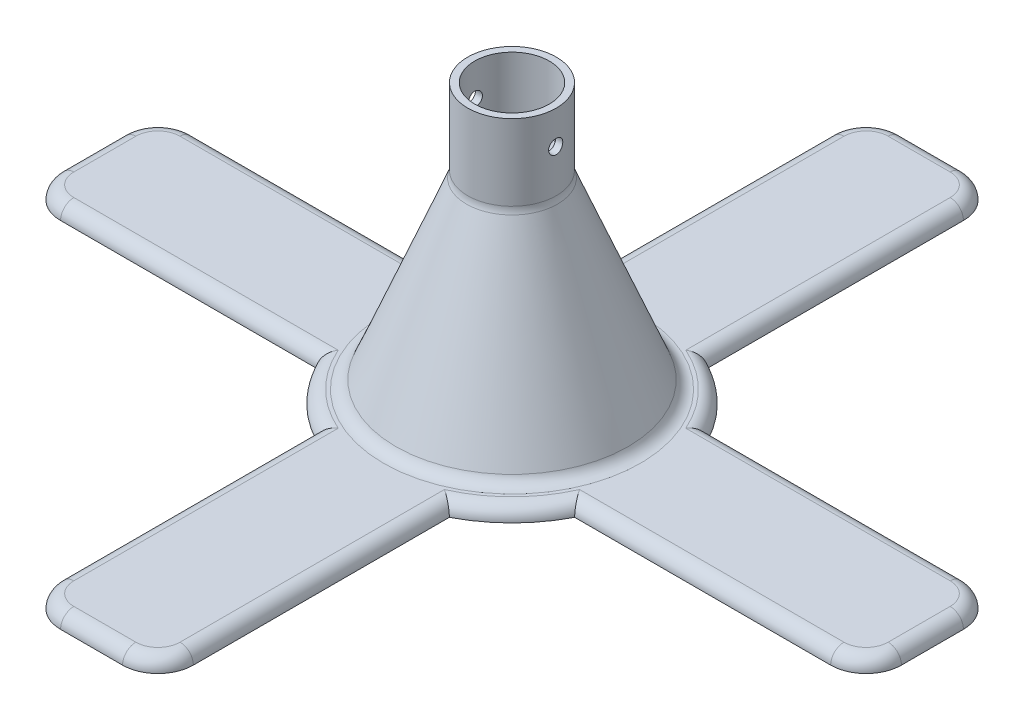
from build123d import *

# Parameters (mm, degrees)
BOSS_EXTRUDE1_DEPTH     = 3
FILLET4_R               = 8
FILLET5_R               = 3
SKETCH4_R               = 10
BOSS_EXTRUDE4_DEPTH     = 60
CHAMFER2_SIZE           = 17
CHAMFER2_SIZE2          = 42.076476508
FILLET7_R               = 4
SKETCH5_R               = 15
CUT_EXTRUDE1_DEPTH      = 32
FILLET8_R               = 3
SKETCH6_R               = 8.43
CUT_EXTRUDE2_DEPTH      = 15
FILLET9_R               = 4
CUT_EXTRUDE3_DEPTH      = 15
CUT_EXTRUDE3_DEPTH_BACK = 15


with BuildPart() as part:
    # Sketch1 → Boss-Extrude1 (new body)
    with BuildSketch(Plane(origin=(0, 0, 0), x_dir=(1, 0, 0), z_dir=(0, 1, 0))):
        with BuildLine():
            ThreePointArc((29.158991571, 15), (31.870032918, 7.716721534), (32.790955909, 0))
            Line((32.790955909, 0), (95, 0))
            Line((95, 0), (95, 15))
            Line((95, 15), (29.158991571, 15))
        make_face()
        with BuildLine():
            Line((95, 0), (32.790955909, 0))
            ThreePointArc((32.790955909, 0), (31.870032918, -7.716721534), (29.158991571, -15))
            Line((29.158991571, -15), (95, -15))
            Line((95, -15), (95, 0))
        make_face()
        with BuildLine():
            ThreePointArc((15, 29.158991571), (7.716721534, 31.870032918), (0, 32.790955909))
            Line((0, 32.790955909), (0, 0))
            Line((0, 0), (32.790955909, 0))
            ThreePointArc((32.790955909, 0), (31.870032918, 7.716721534), (29.158991571, 15))
            ThreePointArc((29.158991571, 15), (23.186707285, 23.186707285), (15, 29.158991571))
        make_face()
        with BuildLine():
            Line((0, 0), (0, 32.790955909))
            ThreePointArc((0, 32.790955909), (-7.716721534, 31.870032918), (-15, 29.158991571))
            ThreePointArc((-15, 29.158991571), (-23.186707285, 23.186707285), (-29.158991571, 15))
            ThreePointArc((-29.158991571, 15), (-31.870032918, 7.716721534), (-32.790955909, 0))
            Line((-32.790955909, 0), (0, 0))
        make_face()
        with BuildLine():
            Line((32.790955909, 0), (0, 0))
            Line((0, 0), (0, -32.790955909))
            ThreePointArc((0, -32.790955909), (7.716721534, -31.870032918), (15, -29.158991571))
            ThreePointArc((15, -29.158991571), (23.186707285, -23.186707285), (29.158991571, -15))
            ThreePointArc((29.158991571, -15), (31.870032918, -7.716721534), (32.790955909, 0))
        make_face()
        with BuildLine():
            Line((0, -32.790955909), (0, 0))
            Line((0, 0), (-32.790955909, 0))
            ThreePointArc((-32.790955909, 0), (-31.870032918, -7.716721534), (-29.158991571, -15))
            ThreePointArc((-29.158991571, -15), (-23.186707285, -23.186707285), (-15, -29.158991571))
            ThreePointArc((-15, -29.158991571), (-7.716721534, -31.870032918), (0, -32.790955909))
        make_face()
        with BuildLine():
            ThreePointArc((15, 29.158991571), (7.716721534, 31.870032918), (0, 32.790955909))
            Line((0, 32.790955909), (0, 0))
            Line((0, 0), (32.790955909, 0))
            ThreePointArc((32.790955909, 0), (31.870032918, 7.716721534), (29.158991571, 15))
            ThreePointArc((29.158991571, 15), (23.186707285, 23.186707285), (15, 29.158991571))
        make_face()
        with BuildLine():
            Line((0, 0), (0, 32.790955909))
            ThreePointArc((0, 32.790955909), (-7.716721534, 31.870032918), (-15, 29.158991571))
            ThreePointArc((-15, 29.158991571), (-23.186707285, 23.186707285), (-29.158991571, 15))
            ThreePointArc((-29.158991571, 15), (-31.870032918, 7.716721534), (-32.790955909, 0))
            Line((-32.790955909, 0), (0, 0))
        make_face()
        with BuildLine():
            Line((32.790955909, 0), (0, 0))
            Line((0, 0), (0, -32.790955909))
            ThreePointArc((0, -32.790955909), (7.716721534, -31.870032918), (15, -29.158991571))
            ThreePointArc((15, -29.158991571), (23.186707285, -23.186707285), (29.158991571, -15))
            ThreePointArc((29.158991571, -15), (31.870032918, -7.716721534), (32.790955909, 0))
        make_face()
        with BuildLine():
            Line((0, -32.790955909), (0, 0))
            Line((0, 0), (-32.790955909, 0))
            ThreePointArc((-32.790955909, 0), (-31.870032918, -7.716721534), (-29.158991571, -15))
            ThreePointArc((-29.158991571, -15), (-23.186707285, -23.186707285), (-15, -29.158991571))
            ThreePointArc((-15, -29.158991571), (-7.716721534, -31.870032918), (0, -32.790955909))
        make_face()
        with BuildLine():
            ThreePointArc((15, 29.158991571), (7.716721534, 31.870032918), (0, 32.790955909))
            Line((0, 32.790955909), (0, 0))
            Line((0, 0), (32.790955909, 0))
            ThreePointArc((32.790955909, 0), (31.870032918, 7.716721534), (29.158991571, 15))
            ThreePointArc((29.158991571, 15), (23.186707285, 23.186707285), (15, 29.158991571))
        make_face()
        with BuildLine():
            Line((0, 0), (0, 32.790955909))
            ThreePointArc((0, 32.790955909), (-7.716721534, 31.870032918), (-15, 29.158991571))
            ThreePointArc((-15, 29.158991571), (-23.186707285, 23.186707285), (-29.158991571, 15))
            ThreePointArc((-29.158991571, 15), (-31.870032918, 7.716721534), (-32.790955909, 0))
            Line((-32.790955909, 0), (0, 0))
        make_face()
        with BuildLine():
            Line((32.790955909, 0), (0, 0))
            Line((0, 0), (0, -32.790955909))
            ThreePointArc((0, -32.790955909), (7.716721534, -31.870032918), (15, -29.158991571))
            ThreePointArc((15, -29.158991571), (23.186707285, -23.186707285), (29.158991571, -15))
            ThreePointArc((29.158991571, -15), (31.870032918, -7.716721534), (32.790955909, 0))
        make_face()
        with BuildLine():
            Line((0, -32.790955909), (0, 0))
            Line((0, 0), (-32.790955909, 0))
            ThreePointArc((-32.790955909, 0), (-31.870032918, -7.716721534), (-29.158991571, -15))
            ThreePointArc((-29.158991571, -15), (-23.186707285, -23.186707285), (-15, -29.158991571))
            ThreePointArc((-15, -29.158991571), (-7.716721534, -31.870032918), (0, -32.790955909))
        make_face()
        with BuildLine():
            ThreePointArc((15, 29.158991571), (7.716721534, 31.870032918), (0, 32.790955909))
            Line((0, 32.790955909), (0, 0))
            Line((0, 0), (32.790955909, 0))
            ThreePointArc((32.790955909, 0), (31.870032918, 7.716721534), (29.158991571, 15))
            ThreePointArc((29.158991571, 15), (23.186707285, 23.186707285), (15, 29.158991571))
        make_face()
        with BuildLine():
            Line((0, 0), (0, 32.790955909))
            ThreePointArc((0, 32.790955909), (-7.716721534, 31.870032918), (-15, 29.158991571))
            ThreePointArc((-15, 29.158991571), (-23.186707285, 23.186707285), (-29.158991571, 15))
            ThreePointArc((-29.158991571, 15), (-31.870032918, 7.716721534), (-32.790955909, 0))
            Line((-32.790955909, 0), (0, 0))
        make_face()
        with BuildLine():
            Line((32.790955909, 0), (0, 0))
            Line((0, 0), (0, -32.790955909))
            ThreePointArc((0, -32.790955909), (7.716721534, -31.870032918), (15, -29.158991571))
            ThreePointArc((15, -29.158991571), (23.186707285, -23.186707285), (29.158991571, -15))
            ThreePointArc((29.158991571, -15), (31.870032918, -7.716721534), (32.790955909, 0))
        make_face()
        with BuildLine():
            Line((0, -32.790955909), (0, 0))
            Line((0, 0), (-32.790955909, 0))
            ThreePointArc((-32.790955909, 0), (-31.870032918, -7.716721534), (-29.158991571, -15))
            ThreePointArc((-29.158991571, -15), (-23.186707285, -23.186707285), (-15, -29.158991571))
            ThreePointArc((-15, -29.158991571), (-7.716721534, -31.870032918), (0, -32.790955909))
        make_face()
        with BuildLine():
            Line((0, 32.790955909), (0, 95))
            Line((0, 95), (-15, 95))
            Line((-15, 95), (-15, 29.158991571))
            ThreePointArc((-15, 29.158991571), (-7.716721534, 31.870032918), (0, 32.790955909))
        make_face()
        with BuildLine():
            Line((15, 95), (0, 95))
            Line((0, 95), (0, 32.790955909))
            ThreePointArc((0, 32.790955909), (7.716721534, 31.870032918), (15, 29.158991571))
            Line((15, 29.158991571), (15, 95))
        make_face()
        with BuildLine():
            Line((-95, 0), (-32.790955909, 0))
            ThreePointArc((-32.790955909, 0), (-31.870032918, 7.716721534), (-29.158991571, 15))
            Line((-29.158991571, 15), (-95, 15))
            Line((-95, 15), (-95, 0))
        make_face()
        with BuildLine():
            ThreePointArc((-29.158991571, -15), (-31.870032918, -7.716721534), (-32.790955909, 0))
            Line((-32.790955909, 0), (-95, 0))
            Line((-95, 0), (-95, -15))
            Line((-95, -15), (-29.158991571, -15))
        make_face()
        with BuildLine():
            Line((0, -95), (0, -32.790955909))
            ThreePointArc((0, -32.790955909), (-7.716721534, -31.870032918), (-15, -29.158991571))
            Line((-15, -29.158991571), (-15, -95))
            Line((-15, -95), (0, -95))
        make_face()
        with BuildLine():
            ThreePointArc((15, -29.158991571), (7.716721534, -31.870032918), (0, -32.790955909))
            Line((0, -32.790955909), (0, -95))
            Line((0, -95), (15, -95))
            Line((15, -95), (15, -29.158991571))
        make_face()
    extrude(amount=BOSS_EXTRUDE1_DEPTH)

    # Fillet4
    fillet4_edges = [part.edges().sort_by_distance(p)[0] for p in [
        (95, 1.5, -15),
        (95, 1.5, 15),
        (15, 1.5, 95),
        (-15, 1.5, 95),
        (-95, 1.5, 15),
        (-95, 1.5, -15),
        (-15, 1.5, -95),
        (15, 1.5, -95),
    ]]
    fillet(fillet4_edges, radius=FILLET4_R)

    # Fillet5
    fillet5_edges = [part.edges().sort_by_distance(p)[0] for p in [
        (-12.656854249, 3, 92.656854249),
        (-15, 3, 58.079495785),
        (-23.186707285, 3, 23.186707285),
        (-58.079495785, 3, 15),
        (-92.656854249, 3, 12.656854249),
        (-95, 3, 0),
        (-92.656854249, 3, -12.656854249),
        (-58.079495785, 3, -15),
        (-23.186707285, 3, -23.186707285),
        (-15, 3, -58.079495785),
        (-12.656854249, 3, -92.656854249),
        (0, 3, -95),
        (12.656854249, 3, -92.656854249),
        (15, 3, -58.079495785),
        (23.186707285, 3, -23.186707285),
        (58.079495785, 3, -15),
        (92.656854249, 3, -12.656854249),
        (95, 3, 0),
        (92.656854249, 3, 12.656854249),
        (58.079495785, 3, 15),
        (23.186707285, 3, 23.186707285),
        (15, 3, 58.079495785),
        (12.656854249, 3, 92.656854249),
        (0, 3, 95),
    ]]
    fillet(fillet5_edges, radius=FILLET5_R - 0.0001)  # a hair under: the kernel refuses the full size

    # Sketch4 → Boss-Extrude4 (add)
    with BuildSketch(Plane(origin=(0, 3, 0), x_dir=(1, 0, 0), z_dir=(0, 1, 0))):
        with Locations(Location((0, 0, 0), (0, 0, 270))):
            Circle(SKETCH4_R)
    extrude(amount=BOSS_EXTRUDE4_DEPTH)

    # Chamfer2
    chamfer2_edges = [part.edges().sort_by_distance(p)[0] for p in [
        (0, 3, -10),
    ]]
    chamfer2_side = [part.faces().sort_by_distance(p)[0] for p in [
        (9.397944217, 3, 57.133640491),
    ]]
    chamfer(chamfer2_edges, length=CHAMFER2_SIZE, length2=CHAMFER2_SIZE2, reference=chamfer2_side[0])

    # Fillet7
    fillet7_edges = [part.edges().sort_by_distance(p)[0] for p in [
        (0, 45.076476508, -10),
    ]]
    fillet(fillet7_edges, radius=FILLET7_R)

    # Sketch5 → Cut-Extrude1 (cut)
    with BuildSketch(Plane.XZ):
        with Locations(Location((0, 0, 0), (0, 0, 270))):
            Circle(SKETCH5_R)
    extrude(amount=-CUT_EXTRUDE1_DEPTH, mode=Mode.SUBTRACT)

    # Fillet8
    fillet8_edges = [part.edges().sort_by_distance(p)[0] for p in [
        (0, 3, -27),
    ]]
    fillet(fillet8_edges, radius=FILLET8_R)

    # Sketch6 → Cut-Extrude2 (cut)
    with BuildSketch(Plane(origin=(0, 63, 0), x_dir=(1, 0, 0), z_dir=(0, 1, 0))):
        with Locations(Location((0, 0, 0), (0, 0, 270))):
            Circle(SKETCH6_R)
    extrude(amount=-CUT_EXTRUDE2_DEPTH, mode=Mode.SUBTRACT)

    # Fillet9
    fillet9_edges = [part.edges().sort_by_distance(p)[0] for p in [
        (0, 32, 15),
    ]]
    fillet(fillet9_edges, radius=FILLET9_R)

    # Sketch8 → Cut-Extrude3 (cut, two sides: drawn at the far end of the back side and taken through both)
    with BuildSketch(Plane(origin=(0, 0, 0), x_dir=(0, 0, -1), z_dir=(1, 0, 0)).offset(-CUT_EXTRUDE3_DEPTH_BACK)):
        with BuildLine():
            Line((0, 55.5), (0, 57.1))
            ThreePointArc((0, 57.1), (-1.6, 55.5), (0, 53.9))
            Line((0, 53.9), (0, 55.5))
        make_face()
        with BuildLine():
            ThreePointArc((1.6, 55.5), (1.13137085, 56.63137085), (0, 57.1))
            Line((0, 57.1), (0, 55.5))
            Line((0, 55.5), (1.6, 55.5))
        make_face()
        with BuildLine():
            Line((1.6, 55.5), (0, 55.5))
            Line((0, 55.5), (0, 53.9))
            ThreePointArc((0, 53.9), (1.13137085, 54.36862915), (1.6, 55.5))
        make_face()
        with BuildLine():
            ThreePointArc((1.6, 55.5), (1.13137085, 56.63137085), (0, 57.1))
            Line((0, 57.1), (0, 55.5))
            Line((0, 55.5), (1.6, 55.5))
        make_face()
        with BuildLine():
            Line((1.6, 55.5), (0, 55.5))
            Line((0, 55.5), (0, 53.9))
            ThreePointArc((0, 53.9), (1.13137085, 54.36862915), (1.6, 55.5))
        make_face()
    extrude(amount=CUT_EXTRUDE3_DEPTH + CUT_EXTRUDE3_DEPTH_BACK, mode=Mode.SUBTRACT)


solid = part.part
